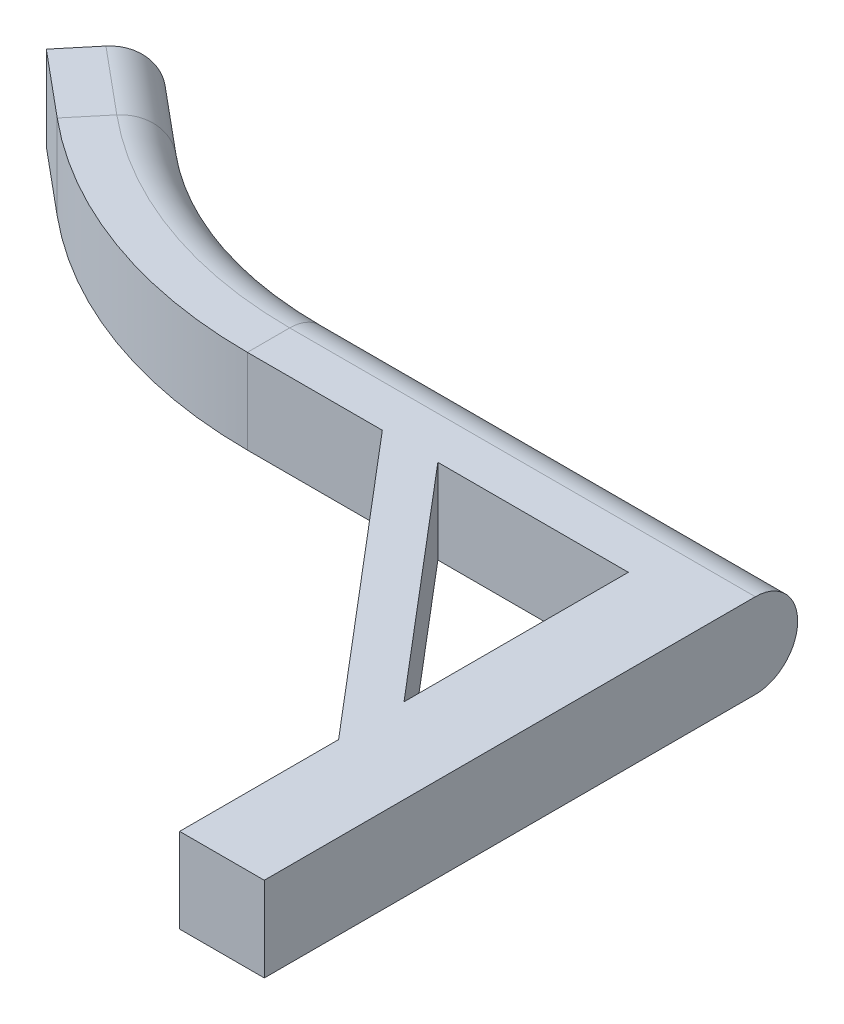
from build123d import *

# Parameters (mm, degrees)
SKETCH2_W           = 5
SKETCH2_H           = 5
FILLET1_R           = 2.5
BOSS_EXTRUDE1_DEPTH = 5


with BuildPart() as part:
    # Sweep1: sweep along a path in Sketch1
    with BuildLine(Plane(origin=(0, 0, 0), x_dir=(1, 0, 0), z_dir=(0, 1, 0))) as sweep1_path:
        Line((0, -14.5), (0, 14.5))
        Line((0, 14.5), (-25, 14.5))
        ThreePointArc((-25, 14.5), (-33.507810594, 15.992189406), (-41, 20.290627288))
        Line((-41, 20.290627288), (-44.841874542, 23.490627288))
    # Sketch2 → Sweep1 (sweep)
    with BuildSketch(Plane.XY.offset(14.5)):
        Rectangle(SKETCH2_W, SKETCH2_H)
    sweep(path=sweep1_path.line, transition=Transition.RIGHT)

    # Fillet1
    fillet1_edges = [part.edges().sort_by_distance(p)[0] for p in [
        (-41.320937271, -2.5, -23.811564559),
        (-32.657029534, -2.5, -18.342970466),
        (-41.320937271, 2.5, -23.811564559),
        (-32.657029534, 2.5, -18.342970466),
        (-11.25, -2.5, -17),
        (-11.25, 2.5, -17),
    ]]
    fillet(fillet1_edges, radius=FILLET1_R - 0.0001)  # a hair under: the kernel refuses the full size

    # Sketch3 → Boss-Extrude1 (add)
    with BuildSketch(Plane(origin=(0, 2.5, 0), x_dir=(1, 0, 0), z_dir=(0, 1, 0))):
        Polygon((-17.029574207, 12), (-2.5, -5.112609621), (-2.5, -1.25), (-13.75, 12), align=None)
    extrude(amount=-BOSS_EXTRUDE1_DEPTH)


solid = part.part
